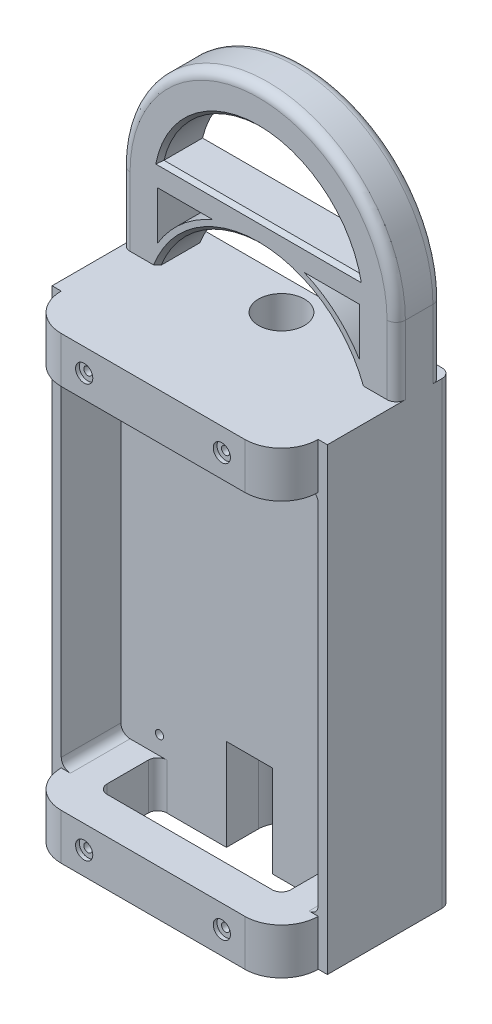
from build123d import *

# Parameters (mm, degrees)
BOSS_EXTRUDE1_DEPTH                                 = 127
FILLET1_R                                           = 12.7
SKETCH2_W                                           = 76.20000000000002
SKETCH2_H                                           = 12.700000000000003
BOSS_EXTRUDE6_DEPTH                                 = 57.15
CUT_EXTRUDE2_DEPTH                                  = 12.7
CUT_EXTRUDE7_START                                  = -127
CUT_EXTRUDE7_DEPTH                                  = 127
CUT_EXTRUDE8_START                                  = -114.3
CUT_EXTRUDE8_DEPTH                                  = 114.3
CUT_EXTRUDE9_DEPTH                                  = 124.46000000000001
CUT_EXTRUDE10_DEPTH                                 = 114.3
CUT_EXTRUDE11_DEPTH                                 = 124.46000000000001
SKETCH6_12_R                                        = 6.350000000000001
CUT_EXTRUDE12_DEPTH                                 = 127
BOSS_EXTRUDE7_DEPTH                                 = 12.7
BOSS_EXTRUDE8_START                                 = -12.7
BOSS_EXTRUDE8_DEPTH                                 = 12.7
CBORE_FOR_1_BINDING_HEAD_MACHINE_SCREW1_D           = 2.2606
CBORE_FOR_1_BINDING_HEAD_MACHINE_SCREW1_DEPTH       = 7.62
CBORE_FOR_1_BINDING_HEAD_MACHINE_SCREW1_CBORE_D     = 4.7625
CBORE_FOR_1_BINDING_HEAD_MACHINE_SCREW1_CBORE_DEPTH = 1.0414
CBORE_FOR_1_BINDING_HEAD_MACHINE_SCREW1_TIP         = 0.6791527576868515
CUT_EXTRUDE13_DEPTH                                 = 127
FILLET5_R                                           = 2.54
FILLET6_R                                           = 2.54
CHAMFER1_SIZE                                       = 1.016
CHAMFER2_SIZE                                       = 1.016
CUT_EXTRUDE14_DEPTH                                 = 25.4
FILLET7_R                                           = 2.54
FILLET8_R                                           = 2.54
FILLET9_R                                           = 2.54
F_4_40_TAPPED_HOLE1_D                               = 2.2606
F_4_40_TAPPED_HOLE1_DEPTH                           = 2.286
F_4_40_TAPPED_HOLE1_TIP                             = 0.6791527576868515


with BuildPart() as part:
    # Sketch1 → Boss-Extrude1 (new body)
    with BuildSketch(Plane(origin=(0, 0, 0), x_dir=(1, 0, 0), z_dir=(0, 1, 0))):
        Polygon((-38.10000000000001, 38.100000000000016), (38.099999999999994, 38.100000000000016), (38.10000000000001, -38.09999999999999), (-38.099999999999994, -38.09999999999999), align=None)
    extrude(amount=BOSS_EXTRUDE1_DEPTH)

    # Fillet1
    fillet1_edges = [part.edges().sort_by_distance(p)[0] for p in [
        (38.10000000000001, 63.5, 38.09999999999999),
        (-38.099999999999994, 63.5, 38.09999999999999),
        (-38.10000000000001, 63.5, -38.100000000000016),
        (38.099999999999994, 63.5, -38.100000000000016),
    ]]
    fillet(fillet1_edges, radius=FILLET1_R)

    # Sketch2 → Boss-Extrude6 (add)
    with BuildSketch(Plane(origin=(0, 127, 0), x_dir=(1, 0, 0), z_dir=(0, 1, 0))):
        Rectangle(SKETCH2_W, SKETCH2_H)
    extrude(amount=BOSS_EXTRUDE6_DEPTH)

    # Sketch5 → Cut-Extrude2 (cut)
    with BuildSketch(Plane.XY.offset(6.350000000000001)):
        with BuildLine():
            Line((-38.10000000000001, 184.15), (-38.1, 146.05))
            ThreePointArc((-38.1, 146.05), (-26.940768363207475, 172.99076836320748), (-2.24e-15, 184.15000000000003))
            Line((0, 184.15), (-38.10000000000001, 184.15))
        make_face()
        with BuildLine():
            ThreePointArc((-3.5001e-13, 173.99), (-17.329273526921128, 167.96665756973795), (-27.186811297197842, 152.49367065348287))
            Line((-27.186811297197842, 152.49367065348287), (3.88e-15, 152.49367065348287))
            Line((3.88e-15, 152.49367065348287), (1.24e-15, 173.99))
        make_face()
        with BuildLine():
            Line((1.24e-15, 173.99), (3.88e-15, 152.49367065348287))
            Line((3.88e-15, 152.49367065348287), (27.18681129719785, 152.49367065348287))
            ThreePointArc((27.18681129719785, 152.49367065348287), (17.329273526920858, 167.96665756973817), (-3.5001e-13, 173.99))
        make_face()
        with BuildLine():
            Line((-27.940000000000005, 146.05), (-27.940000000000005, 132.74318050857906))
            ThreePointArc((-27.94000000000131, 132.7431805085794), (-21.33712693880746, 140.62248493937113), (-12.606522650330419, 146.05000000000067))
            Line((-12.606522650330286, 146.05), (-27.940000000000005, 146.05))
        make_face()
        with BuildLine():
            ThreePointArc((12.606522650330444, 146.05000000000067), (21.337126938807486, 140.62248493937113), (27.940000000001312, 132.7431805085794))
            Line((27.940000000000012, 132.74318050857906), (27.940000000000012, 146.05))
            Line((27.940000000000012, 146.05), (12.606522650330312, 146.05))
        make_face()
        with BuildLine():
            ThreePointArc((4.67e-15, 146.05), (-16.908179233731822, 140.83432954280667), (-27.939999999999998, 127))
            Line((-27.940000000000005, 127), (27.940000000000012, 127))
            ThreePointArc((27.94, 127), (16.90817923373183, 140.83432954280667), (4.67e-15, 146.05))
        make_face()
        with BuildLine():
            ThreePointArc((-2.24e-15, 184.15000000000003), (26.940768363207454, 172.9907683632075), (38.09999999999999, 146.05))
            Line((38.10000000000001, 146.05), (38.10000000000001, 184.15))
            Line((38.10000000000001, 184.15), (0, 184.15))
        make_face()
    extrude(amount=-CUT_EXTRUDE2_DEPTH, mode=Mode.SUBTRACT)

    # Sketch6 → Cut-Extrude7 (cut)
    with BuildSketch(Plane.XZ.offset(CUT_EXTRUDE7_START)):
        with BuildLine():
            ThreePointArc((-25.400000000000002, 38.09999999999999), (-34.380256121069166, 34.38025612106913), (-38.099999999999994, 25.399999999999956))
            Line((-38.099999999999994, 25.399999999999956), (-35.559999999999995, 25.399999999999956))
            ThreePointArc((-35.559999999999995, 25.399999999999956), (-32.58420489685533, 32.5842048968553), (-25.400000000000002, 35.55999999999999))
            Line((-25.400000000000002, 35.55999999999999), (25.39999999999998, 35.55999999999999))
            ThreePointArc((25.39999999999998, 35.55999999999999), (32.58420489685533, 32.58420489685531), (35.56000000000001, 25.39999999999996))
            Line((35.56, 25.399999999999956), (38.10000000000001, 25.399999999999956))
            ThreePointArc((38.10000000000001, 25.399999999999956), (34.38025612106916, 34.38025612106914), (25.399999999999977, 38.09999999999998))
            Line((25.399999999999977, 38.09999999999999), (-25.400000000000006, 38.09999999999999))
        make_face()
    extrude(amount=CUT_EXTRUDE7_DEPTH, mode=Mode.SUBTRACT)

    # Sketch6<7> → Cut-Extrude8 (cut)
    with BuildSketch(Plane.XZ.offset(CUT_EXTRUDE8_START)):
        with BuildLine():
            ThreePointArc((-25.400000000000002, 35.55999999999999), (-32.58420489685533, 32.5842048968553), (-35.559999999999995, 25.399999999999956))
            Line((-35.559999999999995, 25.399999999999956), (-25.4, 25.399999999999956))
            Line((-25.4, 25.399999999999956), (25.400000000000006, 25.399999999999956))
            Line((25.400000000000006, 25.399999999999956), (35.56, 25.399999999999956))
            ThreePointArc((35.56000000000001, 25.39999999999996), (32.58420489685533, 32.58420489685531), (25.39999999999998, 35.55999999999999))
            Line((25.39999999999998, 35.55999999999999), (-25.400000000000002, 35.55999999999999))
        make_face()
    extrude(amount=CUT_EXTRUDE8_DEPTH, mode=Mode.SUBTRACT)

    # Sketch6<8> → Cut-Extrude9 (cut)
    with BuildSketch(Plane.XZ):
        with BuildLine():
            Line((35.55999999999999, -8.889999999999985), (-35.55999999999999, -8.889999999999999))
            Line((-35.56, -8.89), (-35.56000000000001, -25.400000000000013))
            ThreePointArc((-35.56000000000001, -25.400000000000016), (-32.58420489685533, -32.58420489685534), (-25.400000000000006, -35.56000000000002))
            Line((-25.400000000000006, -35.56000000000002), (25.399999999999963, -35.56000000000002))
            ThreePointArc((25.399999999999967, -35.56000000000002), (32.584204896855304, -32.58420489685535), (35.559999999999995, -25.40000000000002))
            Line((35.559999999999995, -25.40000000000002), (35.56, -8.889999999999986))
        make_face()
    extrude(amount=-CUT_EXTRUDE9_DEPTH, mode=Mode.SUBTRACT)

    # Sketch6<9> → Cut-Extrude10 (cut)
    with BuildSketch(Plane.XZ):
        Polygon((-25.4, 25.399999999999956), (-35.559999999999995, 25.399999999999956), (-35.56, 8.89), (-25.4, 8.89), align=None)
        Polygon((35.56, 25.399999999999956), (25.400000000000006, 25.399999999999956), (25.400000000000006, 8.890000000000008), (35.559999999999995, 8.890000000000013), align=None)
    extrude(amount=-CUT_EXTRUDE10_DEPTH, mode=Mode.SUBTRACT)

    # Sketch6<10> → Cut-Extrude11 (cut)
    with BuildSketch(Plane.XZ):
        Polygon((25.400000000000006, 25.399999999999956), (-25.4, 25.399999999999956), (-25.4, 8.890000000000004), (25.400000000000006, 8.890000000000011), align=None)
    extrude(amount=-CUT_EXTRUDE11_DEPTH, mode=Mode.SUBTRACT)

    # Sketch6<12> → Cut-Extrude12 (cut)
    with BuildSketch(Plane.XZ):
        with Locations(Location((0, 0, 0), (0, 0, 270))):
            Circle(SKETCH6_12_R)
    extrude(amount=-CUT_EXTRUDE12_DEPTH, mode=Mode.SUBTRACT)

    # Sketch6<13> → Boss-Extrude7 (add)
    with BuildSketch(Plane.XZ):
        Polygon((-25.4, 25.399999999999956), (-35.559999999999995, 25.399999999999956), (-35.56, 8.89), (-25.4, 8.89), align=None)
        Polygon((35.56, 25.399999999999956), (25.400000000000006, 25.399999999999956), (25.400000000000006, 8.890000000000008), (35.559999999999995, 8.890000000000013), align=None)
    extrude(amount=-BOSS_EXTRUDE7_DEPTH)

    # Sketch6<14> → Boss-Extrude8 (add)
    with BuildSketch(Plane.XZ.offset(BOSS_EXTRUDE8_START)):
        with BuildLine():
            ThreePointArc((-25.400000000000002, 35.55999999999999), (-32.58420489685533, 32.5842048968553), (-35.559999999999995, 25.399999999999956))
            Line((-35.559999999999995, 25.399999999999956), (-25.4, 25.399999999999956))
            Line((-25.4, 25.399999999999956), (25.400000000000006, 25.399999999999956))
            Line((25.400000000000006, 25.399999999999956), (35.56, 25.399999999999956))
            ThreePointArc((35.56000000000001, 25.39999999999996), (32.58420489685533, 32.58420489685531), (25.39999999999998, 35.55999999999999))
            Line((25.39999999999998, 35.55999999999999), (-25.400000000000002, 35.55999999999999))
        make_face()
    extrude(amount=BOSS_EXTRUDE8_DEPTH)

    # CBORE for #1 Binding Head Machine Screw1
    with Locations(Plane.XY.offset(35.55999999999999)):
        with Locations((-19.05, 120.65), (19.05, 120.65), (-19.05, 6.35), (19.05, 6.35)):
            CounterBoreHole(CBORE_FOR_1_BINDING_HEAD_MACHINE_SCREW1_D / 2, CBORE_FOR_1_BINDING_HEAD_MACHINE_SCREW1_CBORE_D / 2, CBORE_FOR_1_BINDING_HEAD_MACHINE_SCREW1_CBORE_DEPTH, depth=CBORE_FOR_1_BINDING_HEAD_MACHINE_SCREW1_DEPTH)
            with Locations((0, 0, -(CBORE_FOR_1_BINDING_HEAD_MACHINE_SCREW1_DEPTH + CBORE_FOR_1_BINDING_HEAD_MACHINE_SCREW1_TIP / 2))):  # 118° drill point
                Cone(0, CBORE_FOR_1_BINDING_HEAD_MACHINE_SCREW1_D / 2, CBORE_FOR_1_BINDING_HEAD_MACHINE_SCREW1_TIP, mode=Mode.SUBTRACT)

    # Sketch9 → Cut-Extrude13 (cut)
    with BuildSketch(Plane.XZ):
        Polygon((-35.55999999999999, -8.889999999999999), (-38.1, -8.889999999999999), (-38.1, -39.454252630165286), (40.84777292186545, -39.454252630165286), (40.84777292186545, -8.889999999999992), align=None)
    extrude(amount=-CUT_EXTRUDE13_DEPTH, mode=Mode.SUBTRACT)

    # Fillet5
    fillet5_edges = [part.edges().sort_by_distance(p)[0] for p in [
        (-38.1, 63.5, -8.889999999999999),
        (38.10000000000001, 63.5, -8.89),
    ]]
    fillet(fillet5_edges, radius=FILLET5_R)

    # Fillet6
    fillet6_edges = [part.edges().sort_by_distance(p)[0] for p in [
        (-38.10000000000001, 136.525, -6.350000000000001),
        (-38.10000000000001, 136.525, 6.350000000000001),
        (-1.44e-15, 184.15000000000003, -6.349999999999998),
        (-1.44e-15, 184.15000000000003, 6.350000000000001),
        (38.10000000000001, 136.525, -6.350000000000001),
        (38.10000000000001, 136.525, 6.350000000000001),
    ]]
    fillet(fillet6_edges, radius=FILLET6_R)

    # Chamfer1
    chamfer1_edges = [part.edges().sort_by_distance(p)[0] for p in [
        (-2.043e-14, 173.99, 6.350000000000001),
        (7.11e-15, 152.49367065348287, 6.350000000000001),
        (5.24e-14, 173.99, -6.349999999999998),
        (3.55e-15, 152.49367065348287, -6.349999999999998),
    ]]
    chamfer(chamfer1_edges, length=CHAMFER1_SIZE)

    # Chamfer2
    chamfer2_edges = [part.edges().sort_by_distance(p)[0] for p in [
        (8.88e-15, 146.05, 6.350000000000001),
        (-1.599e-14, 146.05, -6.349999999999998),
    ]]
    chamfer(chamfer2_edges, length=CHAMFER2_SIZE)

    # Sketch10 → Cut-Extrude14 (cut)
    with BuildSketch(Plane.XZ):
        with BuildLine():
            Line((6.349999999999994, 8.890000000000008), (-6.350000000000005, 8.890000000000004))
            Line((-6.350000000000005, 8.890000000000004), (-6.350000000000002, 0))
            ThreePointArc((-6.350000000000002, 0), (3.9e-16, -6.350000000000001), (6.350000000000002, 0))
            Line((6.350000000000002, 0), (6.349999999999994, 8.890000000000008))
        make_face()
    extrude(amount=-CUT_EXTRUDE14_DEPTH, mode=Mode.SUBTRACT)

    # Fillet7
    fillet7_edges = [part.edges().sort_by_distance(p)[0] for p in [
        (-25.4, 6.35, 25.39999999999997),
        (-25.4, 6.35, 8.890000000000002),
        (25.400000000000006, 6.35, 8.89000000000001),
        (25.400000000000006, 6.35, 25.39999999999997),
    ]]
    fillet(fillet7_edges, radius=FILLET7_R)

    # Fillet8
    fillet8_edges = [part.edges().sort_by_distance(p)[0] for p in [
        (-25.4, 119.38, 8.890000000000002),
        (-25.4, 119.38, 25.39999999999997),
        (25.400000000000006, 119.38, 25.39999999999997),
        (25.400000000000006, 119.38, 8.89000000000001),
    ]]
    fillet(fillet8_edges, radius=FILLET8_R)

    # Fillet9
    # the kernel refuses this fillet: 2.54 mm, written as the material it adds along each edge
    with BuildSketch(Plane(origin=(-35.559999999999995, 114.3, 25.399999999999956), x_dir=(1, 0, -4.3e-16), z_dir=(-4.3e-16, 0, -1))) as fillet9_piece_1:
        with BuildLine():
            CenterArc((FILLET9_R, FILLET9_R), FILLET9_R, 180, 90)
            Line((0, FILLET9_R), (0, 0))
            Line((0, 0), (FILLET9_R, 0))
        make_face()
    extrude(amount=22.85999999999997)
    with BuildSketch(Plane(origin=(35.56, 114.3, 2.539999999999999), x_dir=(-1, 0, 4.3e-16), z_dir=(4.3e-16, 0, 1))) as fillet9_piece_2:
        with BuildLine():
            CenterArc((FILLET9_R, FILLET9_R), FILLET9_R, 180, 90)
            Line((-7.11e-15, FILLET9_R), (0, 0))
            Line((0, 0), (FILLET9_R, 0))
        make_face()
    extrude(amount=22.859999999999964)
    with BuildSketch(Plane(origin=(-35.559999999999995, 12.7, 25.399999999999956), x_dir=(0, 1, 0), z_dir=(-4.3e-16, 0, -1))) as fillet9_piece_3:
        with BuildLine():
            CenterArc((FILLET9_R, FILLET9_R), FILLET9_R, 180, 90)
            Line((0, FILLET9_R), (0, 0))
            Line((0, 0), (FILLET9_R, 0))
        make_face()
    extrude(amount=22.85999999999997)
    with BuildSketch(Plane(origin=(35.56, 12.7, 2.540000000000017), x_dir=(-1, 0, 4.3e-16), z_dir=(4.3e-16, 0, 1))) as fillet9_piece_4:
        with BuildLine():
            CenterArc((FILLET9_R, -FILLET9_R), FILLET9_R, 90, 90)
            Line((0, -FILLET9_R), (0, 0))
            Line((0, 0), (FILLET9_R, 0))
        make_face()
    extrude(amount=22.859999999999946)

    # #4-40 Tapped Hole1
    with Locations(Plane.XY.offset(8.890000000000006)):
        with Locations((-24.892, 109.22), (24.892, 109.22), (-24.892, 17.78), (24.892, 17.78)):
            Hole(F_4_40_TAPPED_HOLE1_D / 2, depth=F_4_40_TAPPED_HOLE1_DEPTH)
            with Locations((0, 0, -(F_4_40_TAPPED_HOLE1_DEPTH + F_4_40_TAPPED_HOLE1_TIP / 2))):  # 118° drill point
                Cone(0, F_4_40_TAPPED_HOLE1_D / 2, F_4_40_TAPPED_HOLE1_TIP, mode=Mode.SUBTRACT)


solid = part.part
